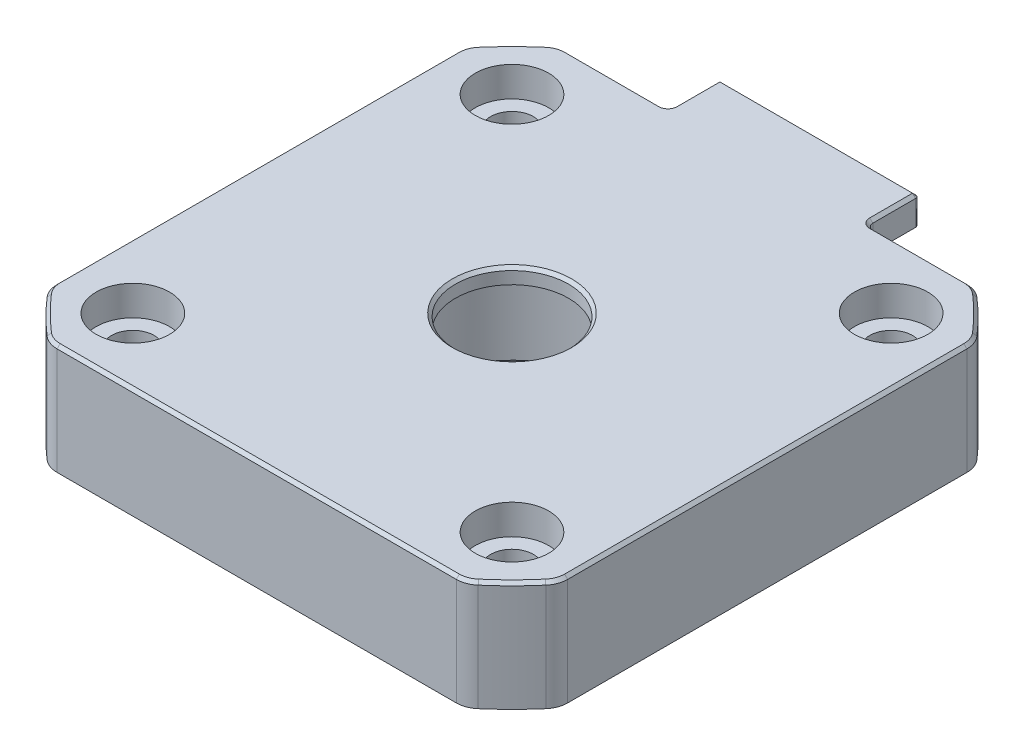
from build123d import *

# Parameters (mm, degrees)
BOSS_EXTRUDE1_DEPTH                              = 2.3
BOSS_EXTRUDE2_START                              = 6.7
BOSS_EXTRUDE2_DEPTH                              = 6.7
BOSS_EXTRUDE3_DEPTH                              = 0.5
SKETCH4_R                                        = 12.925
BOSS_EXTRUDE4_DEPTH                              = 7.6
DRAFT1_ANGLE                                     = 56.309932527
DRAFT2_ANGLE                                     = 56.309932527
DRAFT3_ANGLE                                     = 56.309932527
DRAFT4_ANGLE                                     = 56.309932527
SKETCH5_R                                        = 8.025
CUT_EXTRUDE1_DEPTH                               = 8
CUT_EXTRUDE2_DEPTH                               = 1.65
CBORE_FOR_M8_HEX_HEAD_BOLT1_D                    = 9.25
CBORE_FOR_M8_HEX_HEAD_BOLT1_CBORE_D              = 12
CBORE_FOR_M8_HEX_HEAD_BOLT1_CBORE_DEPTH          = 0.65
CBORE_FOR_M3_HEX_HEAD_MACHINE_SCREW1_D           = 3.5
CBORE_FOR_M3_HEX_HEAD_MACHINE_SCREW1_DEPTH       = 9.9
CBORE_FOR_M3_HEX_HEAD_MACHINE_SCREW1_CBORE_D     = 6
CBORE_FOR_M3_HEX_HEAD_MACHINE_SCREW1_CBORE_DEPTH = 2.45
CHAMFER1_SIZE                                    = 0.25
CHAMFER4_SIZE                                    = 0.5
CHAMFER4_SIZE2                                   = 0.9
FILLET1_R                                        = 0.150000001
FILLET2_R                                        = 0.499999999


with BuildPart() as part:
    # Sketch1 → Boss-Extrude1 (new body)
    with BuildSketch(Plane.XZ.offset(-6.7)):
        with BuildLine():
            Line((8.625, -20.875), (16.316766683, -20.875))
            ThreePointArc((16.316766683, -20.875), (17.01460187, -20.749306819), (17.624723932, -20.388026052))
            ThreePointArc((17.624723932, -20.388026052), (19.056527753, -19.056527753), (20.388026052, -17.624723932))
            ThreePointArc((20.388026052, -17.624723932), (20.749306819, -17.01460187), (20.875, -16.316766683))
            Line((20.875, -16.316766683), (20.875, 16.316766683))
            ThreePointArc((20.875, 16.316766683), (20.749306819, 17.01460187), (20.388026052, 17.624723932))
            ThreePointArc((20.388026052, 17.624723932), (19.056527753, 19.056527753), (17.624723932, 20.388026052))
            ThreePointArc((17.624723932, 20.388026052), (17.01460187, 20.749306819), (16.316766683, 20.875))
            Line((16.316766683, 20.875), (-16.316766683, 20.875))
            ThreePointArc((-16.316766683, 20.875), (-17.01460187, 20.749306819), (-17.624723932, 20.388026052))
            ThreePointArc((-17.624723932, 20.388026052), (-19.056527753, 19.056527753), (-20.388026052, 17.624723932))
            ThreePointArc((-20.388026052, 17.624723932), (-20.749306819, 17.01460187), (-20.875, 16.316766683))
            Line((-20.875, 16.316766683), (-20.875, -16.316766683))
            ThreePointArc((-20.875, -16.316766683), (-20.749306819, -17.01460187), (-20.388026052, -17.624723932))
            ThreePointArc((-20.388026052, -17.624723932), (-19.056527753, -19.056527753), (-17.624723932, -20.388026052))
            ThreePointArc((-17.624723932, -20.388026052), (-17.01460187, -20.749306819), (-16.316766683, -20.875))
            Line((-16.316766683, -20.875), (-8.625, -20.875))
            ThreePointArc((-8.625, -20.875), (-8.271446609, -21.02144661), (-8.125, -21.375))
            Line((-8.125, -21.375), (-8.125, -24.875))
            ThreePointArc((-8.125, -24.875), (-8.051776696, -25.051776693), (-7.875000003, -25.124999997))
            Line((-7.875000003, -25.124999997), (7.875000003, -25.124999997))
            ThreePointArc((7.875000003, -25.124999997), (8.051776696, -25.051776693), (8.125, -24.875))
            Line((8.125, -24.875), (8.125, -21.375))
            ThreePointArc((8.125, -21.375), (8.271446609, -21.02144661), (8.625, -20.875))
        make_face()
    extrude(amount=-BOSS_EXTRUDE1_DEPTH)

    # Sketch2 → Boss-Extrude2 (add)
    with BuildSketch(Plane.XZ.offset(-6.7).offset(BOSS_EXTRUDE2_START)):
        with BuildLine():
            Line((-8.2, -19.791378029), (-8.2, -20.875))
            Line((-8.2, -20.875), (-16.316766683, -20.875))
            ThreePointArc((-16.316766683, -20.875), (-17.01460187, -20.749306819), (-17.624723932, -20.388026052))
            ThreePointArc((-17.624723932, -20.388026052), (-19.056527753, -19.056527753), (-20.388026052, -17.624723932))
            ThreePointArc((-20.388026052, -17.624723932), (-20.749306819, -17.01460187), (-20.875, -16.316766683))
            Line((-20.875, -16.316766683), (-20.875, 16.316766683))
            ThreePointArc((-20.875, 16.316766683), (-20.749306819, 17.01460187), (-20.388026052, 17.624723932))
            ThreePointArc((-20.388026052, 17.624723932), (-19.056527753, 19.056527753), (-17.624723932, 20.388026052))
            ThreePointArc((-17.624723932, 20.388026052), (-17.01460187, 20.749306819), (-16.316766683, 20.875))
            Line((-16.316766683, 20.875), (16.316766683, 20.875))
            ThreePointArc((16.316766683, 20.875), (17.01460187, 20.749306819), (17.624723932, 20.388026052))
            ThreePointArc((17.624723932, 20.388026052), (19.056527753, 19.056527753), (20.388026052, 17.624723932))
            ThreePointArc((20.388026052, 17.624723932), (20.749306819, 17.01460187), (20.875, 16.316766683))
            Line((20.875, 16.316766683), (20.875, -16.316766683))
            ThreePointArc((20.875, -16.316766683), (20.749306819, -17.01460187), (20.388026052, -17.624723932))
            ThreePointArc((20.388026052, -17.624723932), (19.056527753, -19.056527753), (17.624723932, -20.388026052))
            ThreePointArc((17.624723932, -20.388026052), (17.01460187, -20.749306819), (16.316766683, -20.875))
            Line((16.316766683, -20.875), (8.199999996, -20.875))
            Line((8.199999996, -20.875), (8.199999996, -19.791378029))
            ThreePointArc((8.199999996, -19.791378029), (8.276120463, -19.408694597), (8.492893215, -19.084271248))
            Line((8.492893215, -19.084271248), (19.207106777, -8.370057685))
            ThreePointArc((19.207106777, -8.370057685), (19.423879528, -8.045634337), (19.499999995, -7.662950906))
            Line((19.499999995, -7.662950906), (19.499999995, 7.662950902))
            ThreePointArc((19.499999995, 7.662950902), (19.423879528, 8.045634333), (19.207106777, 8.370057681))
            Line((19.207106777, 8.370057681), (8.370057681, 19.207106777))
            ThreePointArc((8.370057681, 19.207106777), (8.045634333, 19.423879528), (7.662950902, 19.499999995))
            Line((7.662950902, 19.499999995), (-7.662950906, 19.499999995))
            ThreePointArc((-7.662950906, 19.499999995), (-8.045634337, 19.423879528), (-8.370057685, 19.207106777))
            Line((-8.370057685, 19.207106777), (-19.207106781, 8.370057681))
            ThreePointArc((-19.207106781, 8.370057681), (-19.423879532, 8.045634333), (-19.499999999, 7.662950902))
            Line((-19.499999999, 7.662950902), (-19.499999999, -7.662950906))
            ThreePointArc((-19.499999999, -7.662950906), (-19.423879532, -8.045634337), (-19.207106781, -8.370057685))
            Line((-19.207106781, -8.370057685), (-8.492893219, -19.084271248))
            ThreePointArc((-8.492893219, -19.084271248), (-8.276120467, -19.408694597), (-8.2, -19.791378029))
        make_face()
    extrude(amount=-BOSS_EXTRUDE2_DEPTH)

    # Sketch3 → Boss-Extrude3 (add)
    with BuildSketch(Plane.XZ.offset(-6.7)):
        with BuildLine():
            Line((-11.809681219, -15.767483247), (-15.767483247, -11.809681219))
            ThreePointArc((-15.767483247, -11.809681219), (-12.88370491, -12.88370491), (-11.809681219, -15.767483247))
        make_face()
        with BuildLine():
            Line((-15.767483247, 11.809681219), (-11.809681219, 15.767483247))
            ThreePointArc((-11.809681219, 15.767483247), (-12.88370491, 12.88370491), (-15.767483247, 11.809681219))
        make_face()
        with BuildLine():
            Line((15.767483247, -11.809681219), (11.809681219, -15.767483247))
            ThreePointArc((11.809681219, -15.767483247), (12.88370491, -12.88370491), (15.767483247, -11.809681219))
        make_face()
        with BuildLine():
            Line((11.809681219, 15.767483247), (15.767483247, 11.809681219))
            ThreePointArc((15.767483247, 11.809681219), (12.88370491, 12.88370491), (11.809681219, 15.767483247))
        make_face()
    extrude(amount=BOSS_EXTRUDE3_DEPTH)

    # Sketch4 → Boss-Extrude4 (add)
    with BuildSketch(Plane.XZ.offset(-6.7)):
        with Locations(Location((0, 0, 0), (0, 0, 90))):
            Circle(SKETCH4_R)
    extrude(amount=BOSS_EXTRUDE4_DEPTH)

    # Draft1
    draft1_faces = [part.faces().sort_by_distance(p)[0] for p in [
        (-12.88370491, 6.45, -12.88370491),
    ]]
    draft(draft1_faces, Plane(origin=(-15.5, 6.2, -15.5), x_dir=(0, 0, -1), z_dir=(0, -1, 0)), DRAFT1_ANGLE)

    # Draft2
    draft2_faces = [part.faces().sort_by_distance(p)[0] for p in [
        (-12.88370491, 6.45, 12.88370491),
    ]]
    draft(draft2_faces, Plane(origin=(-15.5, 6.2, 15.5), x_dir=(0, 0, -1), z_dir=(0, -1, 0)), DRAFT2_ANGLE)

    # Draft3
    draft3_faces = [part.faces().sort_by_distance(p)[0] for p in [
        (12.88370491, 6.45, 12.88370491),
    ]]
    draft(draft3_faces, Plane(origin=(15.5, 6.2, 15.5), x_dir=(0, 0, -1), z_dir=(0, -1, 0)), DRAFT3_ANGLE)

    # Draft4
    draft4_faces = [part.faces().sort_by_distance(p)[0] for p in [
        (12.88370491, 6.45, -12.88370491),
    ]]
    draft(draft4_faces, Plane(origin=(15.5, 6.2, -15.5), x_dir=(0, 0, -1), z_dir=(0, -1, 0)), DRAFT4_ANGLE)

    # Sketch5 → Cut-Extrude1 (cut)
    with BuildSketch(Plane.XZ.offset(0.9)):
        with Locations(Location((0, 0, 0), (0, 0, 90))):
            Circle(SKETCH5_R)
    extrude(amount=-CUT_EXTRUDE1_DEPTH, mode=Mode.SUBTRACT)

    # Sketch6 → Cut-Extrude2 (cut)
    with BuildSketch(Plane.XZ.offset(-6.7)):
        with BuildLine():
            Line((6.95, -16.775), (-6.95, -16.775))
            ThreePointArc((-6.95, -16.775), (-7.126776695, -16.848223305), (-7.2, -17.025))
            Line((-7.2, -17.025), (-7.2, -23.925))
            ThreePointArc((-7.2, -23.925), (-7.126776695, -24.101776695), (-6.95, -24.175))
            Line((-6.95, -24.175), (6.95, -24.175))
            ThreePointArc((6.95, -24.175), (7.126776695, -24.101776695), (7.2, -23.925))
            Line((7.2, -23.925), (7.2, -17.025))
            ThreePointArc((7.2, -17.025), (7.126776695, -16.848223305), (6.95, -16.775))
        make_face()
    extrude(amount=-CUT_EXTRUDE2_DEPTH, mode=Mode.SUBTRACT)

    # CBORE for M8 Hex Head Bolt1 (through all)
    with Locations(Plane(origin=(0, 7.1, 0), x_dir=(-1, 0, 0), z_dir=(0, -1, 0))):
        with Locations((0, 0)):
            CounterBoreHole(CBORE_FOR_M8_HEX_HEAD_BOLT1_D / 2, CBORE_FOR_M8_HEX_HEAD_BOLT1_CBORE_D / 2, CBORE_FOR_M8_HEX_HEAD_BOLT1_CBORE_DEPTH)

    # CBORE for M3 Hex Head Machine Screw1
    with Locations(Plane(origin=(0, 9, 0), x_dir=(1, 0, 0), z_dir=(0, 1, 0))):
        with Locations((15.5, 15.5), (15.5, -15.5), (-15.5, 15.5), (-15.5, -15.5)):
            CounterBoreHole(CBORE_FOR_M3_HEX_HEAD_MACHINE_SCREW1_D / 2, CBORE_FOR_M3_HEX_HEAD_MACHINE_SCREW1_CBORE_D / 2, CBORE_FOR_M3_HEX_HEAD_MACHINE_SCREW1_CBORE_DEPTH, depth=CBORE_FOR_M3_HEX_HEAD_MACHINE_SCREW1_DEPTH)

    # Chamfer1
    chamfer1_edges = [part.edges().sort_by_distance(p)[0] for p in [
        (20.749306819, 9, -17.01460187),
        (20.875, 9, 0),
        (20.749306819, 9, 17.01460187),
        (19.056527753, 9, 19.056527753),
        (0, -0.9, -12.925),
        (17.01460187, 9, 20.749306819),
        (6, 7.1, 0),
        (-4.625, 9, 0),
        (0, 9, 20.875),
        (-17.01460187, 9, 20.749306819),
        (-19.056527753, 9, 19.056527753),
        (-20.749306819, 9, 17.01460187),
        (-20.875, 9, 0),
        (17.01460187, 9, -20.749306819),
        (-20.749306819, 9, -17.01460187),
        (-19.056527753, 9, -19.056527753),
        (-17.01460187, 9, -20.749306819),
        (-12.470883342, 9, -20.875),
        (-8.271446609, 9, -21.02144661),
        (-8.125, 9, -23.125),
        (-8.051776696, 9, -25.051776693),
        (0, 9, -25.124999997),
        (8.051776696, 9, -25.051776693),
        (8.125, 9, -23.125),
        (19.056527753, 9, -19.056527753),
        (8.271446609, 9, -21.02144661),
        (12.470883342, 9, -20.875),
    ]]
    chamfer(chamfer1_edges, length=CHAMFER1_SIZE - 0.0001)  # a hair under: the kernel refuses the full size

    # Chamfer4
    chamfer4_edges = [part.edges().sort_by_distance(p)[0] for p in [
        (0, -0.9, -8.025),
    ]]
    chamfer4_side = [part.faces().sort_by_distance(p)[0] for p in [
        (0, -0.9, -12.316594034),
    ]]
    chamfer(chamfer4_edges, length=CHAMFER4_SIZE, length2=CHAMFER4_SIZE2, reference=chamfer4_side[0])

    # Fillet1
    fillet1_edges = [part.edges().sort_by_distance(p)[0] for p in [
        (0, 6.7, -12.925),
    ]]
    fillet(fillet1_edges, radius=FILLET1_R)

    # Fillet2
    fillet2_edges = [part.edges().sort_by_distance(p)[0] for p in [
        (-12.353374823, 6.7, -12.353374823),
        (12.353374823, 6.7, -12.353374823),
        (12.88370491, 6.2, -12.88370491),
    ]]
    fillet(fillet2_edges, radius=FILLET2_R)


solid = part.part
